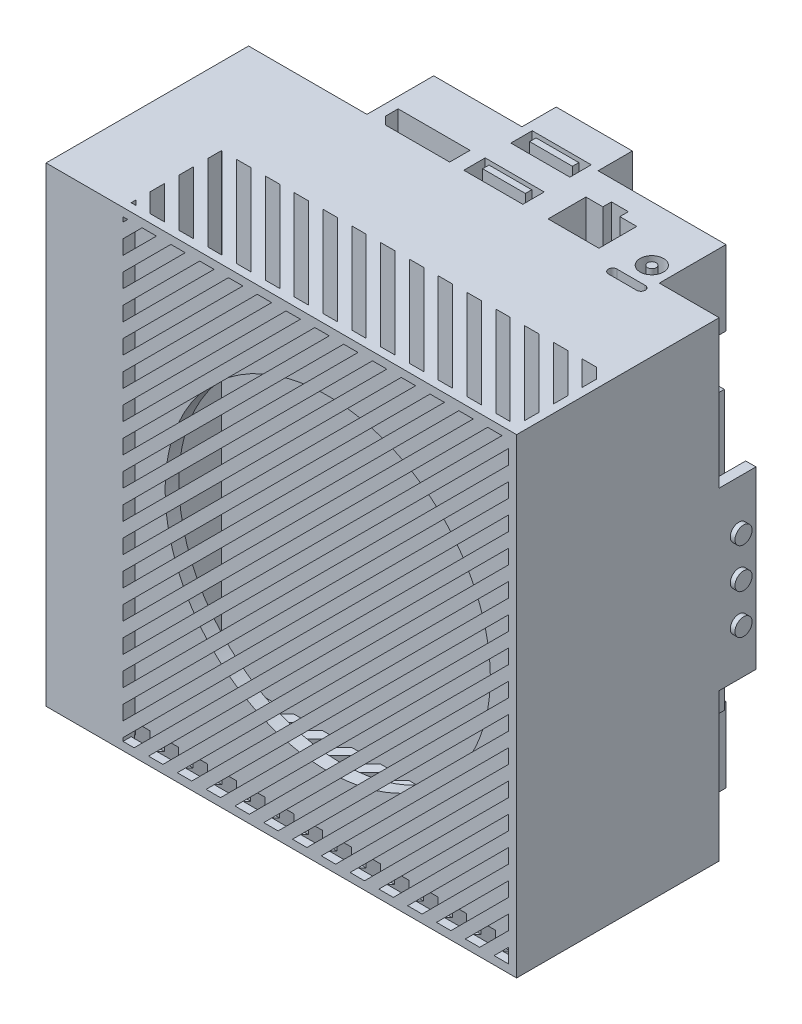
from build123d import *

# Parameters (mm, degrees)
ESQUISSE1_W              = 110
ESQUISSE1_H              = 110
ESQUISSE1_R              = 3.1
ESQUISSE1_W_2            = 105.2
ESQUISSE1_H_2            = 75
BOSS_EXTRU_1_DEPTH       = 23.6
ESQUISSE3_W              = 110
ESQUISSE3_H              = 110
BOSS_EXTRU_2_DEPTH       = 47.35
ESQUISSE15_R             = 1.25
ENL_V_MAT_EXTRU_11_DEPTH = 10
ESQUISSE4_W              = 2.4
ESQUISSE4_H              = 41
ENL_V_MAT_EXTRU_1_DEPTH  = 15
ESQUISSE5_R              = 2
BOSS_EXTRU_3_DEPTH       = 1.1
ESQUISSE6_W              = 95.2
ESQUISSE6_H              = 65
BOSS_EXTRU_4_DEPTH       = 8.6
ENL_V_MAT_EXTRU_2_DEPTH  = 2.8
ESQUISSE8_R              = 38
ENL_V_MAT_EXTRU_3_DEPTH  = 20.14
ENL_V_MAT_EXTRU_4_DEPTH  = 4.4
ENL_V_MAT_EXTRU_5_DEPTH  = 4.4
ENL_V_MAT_EXTRU_7_REACH  = 170.182
ESQUISSE11_W             = 90.1
ESQUISSE11_H             = 17
ESQUISSE12_W             = 54.13
ESQUISSE12_H             = 6.55
ESQUISSE12_W_2           = 12.5
ESQUISSE12_H_2           = 5
ESQUISSE12_W_3           = 10
ESQUISSE12_H_3           = 1.5
ENL_V_MAT_EXTRU_8_DEPTH  = 10
ESQUISSE13_R             = 2.75
ESQUISSE13_R_2           = 1
ESQUISSE13_W             = 13.8
ESQUISSE13_H             = 5
ESQUISSE13_W_2           = 10
ESQUISSE13_H_2           = 1.5
ENL_V_MAT_EXTRU_9_DEPTH  = 10
ESQUISSE14_W             = 10
ESQUISSE14_H             = 17.5
ENL_V_MAT_EXTRU_10_DEPTH = 23.6
ESQUISSE16_W             = 20.63
ESQUISSE16_H             = 18.232262646
ESQUISSE16_W_2           = 29.9
ESQUISSE16_H_2           = 17.5
ESQUISSE16_W_3           = 68.33
ENL_V_MAT_EXTRU_12_DEPTH = 8
ESQUISSE17_W             = 17.67
ESQUISSE17_H             = 17.5
ENL_V_MAT_EXTRU_13_DEPTH = 17


with BuildPart() as part:
    # Esquisse1 → Boss.-Extru.1 (new body)
    with BuildSketch(Plane.XY):
        with Locations((-55, -55)):
            Rectangle(ESQUISSE1_W, ESQUISSE1_H)
        with Locations((-87.5, -9)):
            Circle(ESQUISSE1_R, mode=Mode.SUBTRACT)
        with Locations((-8.5, -9)):
            Circle(ESQUISSE1_R, mode=Mode.SUBTRACT)
        with Locations((-87.5, -101)):
            Circle(ESQUISSE1_R, mode=Mode.SUBTRACT)
        with Locations((-8.5, -101)):
            Circle(ESQUISSE1_R, mode=Mode.SUBTRACT)
        with Locations((-55, -55)):
            Rectangle(ESQUISSE1_W_2, ESQUISSE1_H_2, mode=Mode.SUBTRACT)
    extrude(amount=BOSS_EXTRU_1_DEPTH)

    # Esquisse3 → Boss.-Extru.2 (add)
    with BuildSketch(Plane.XY.offset(23.6)):
        with Locations((-55, -55)):
            Rectangle(ESQUISSE3_W, ESQUISSE3_H)
    extrude(amount=BOSS_EXTRU_2_DEPTH)

    # Esquisse15 → Enlèv. mat.-Extru.11 (cut)
    with BuildSketch(Plane(origin=(0, 0, 23.6), x_dir=(-1, 0, 0), z_dir=(0, 0, -1))):
        with Locations((87.5, -9)):
            Circle(ESQUISSE15_R)
        with Locations((8.5, -9)):
            Circle(ESQUISSE15_R)
        with Locations((8.5, -101)):
            Circle(ESQUISSE15_R)
        with Locations((87.5, -101)):
            Circle(ESQUISSE15_R)
    extrude(amount=-ENL_V_MAT_EXTRU_11_DEPTH, mode=Mode.SUBTRACT)

    # Esquisse4 → Enlèv. mat.-Extru.1 (cut)
    with BuildSketch(Plane(origin=(0, 0, 0), x_dir=(-1, 0, 0), z_dir=(0, 0, -1))):
        with Locations((1.2, -55)):
            Rectangle(ESQUISSE4_W, ESQUISSE4_H)
    extrude(amount=-ENL_V_MAT_EXTRU_1_DEPTH, mode=Mode.SUBTRACT)

    # Esquisse5 → Boss.-Extru.3 (add)
    with BuildSketch(Plane(origin=(0, 0, 0), x_dir=(0, 0, -1), z_dir=(1, 0, 0))):
        with Locations(Location((-19, -45.7, 0), (0, 0, 180))):
            Circle(ESQUISSE5_R)
        with Locations(Location((-19, -55, 0), (0, 0, 180))):
            Circle(ESQUISSE5_R)
        with Locations(Location((-19, -64.3, 0), (0, 0, 180))):
            Circle(ESQUISSE5_R)
    extrude(amount=BOSS_EXTRU_3_DEPTH)

    # Esquisse6 → Boss.-Extru.4 (add)
    with BuildSketch(Plane(origin=(0, 0, 23.6), x_dir=(-1, 0, 0), z_dir=(0, 0, -1))):
        with Locations((55, -55)):
            Rectangle(ESQUISSE6_W, ESQUISSE6_H)
    extrude(amount=BOSS_EXTRU_4_DEPTH)

    # Esquisse7 → Enlèv. mat.-Extru.2 (cut)
    with BuildSketch(Plane.XY.offset(70.95)):
        Polygon((-1.9, -101.368343443), (-8.631656557, -108.1), (-11.997484835, -108.1), (-1.9, -98.002515165), align=None)
        Polygon((-1.9, -108.1), (-1.9, -104.734171722), (-5.265828278, -108.1), align=None)
        Polygon((-1.9, -94.636686886), (-15.363313114, -108.1), (-18.729141392, -108.1), (-1.9, -91.270858608), align=None)
        Polygon((-1.9, -87.905030329), (-22.094969671, -108.1), (-25.460797949, -108.1), (-1.9, -84.539202051), align=None)
        Polygon((-1.9, -81.173373772), (-28.826626228, -108.1), (-32.192454506, -108.1), (-1.9, -77.807545494), align=None)
        Polygon((-1.9, -74.441717216), (-35.558282784, -108.1), (-38.924111063, -108.1), (-1.9, -71.075888937), align=None)
        Polygon((-1.9, -67.710060659), (-42.289939341, -108.1), (-45.65576762, -108.1), (-1.9, -64.34423238), align=None)
        Polygon((-1.9, -60.978404102), (-49.021595898, -108.1), (-52.387424177, -108.1), (-1.9, -57.612575823), align=None)
        Polygon((-1.9, -54.246747545), (-55.753252455, -108.1), (-59.119080734, -108.1), (-1.9, -50.880919266), align=None)
        Polygon((-1.9, -47.515090988), (-62.484909012, -108.1), (-65.850737291, -108.1), (-1.9, -44.149262709), align=None)
        Polygon((-69.216565569, -108.1), (-1.9, -40.783434431), (-1.9, -37.417606153), (-72.582393847, -108.1), align=None)
        Polygon((-1.9, -34.051777874), (-75.948222126, -108.1), (-79.314050404, -108.1), (-1.9, -30.685949596), align=None)
        Polygon((-82.679878683, -108.1), (-86.045706961, -108.1), (-1.9, -23.954293039), (-1.9, -27.320121317), align=None)
        Polygon((-92, -107.322636482), (-1.9, -17.222636482), (-1.9, -20.58846476), (-89.41153524, -108.1), (-92, -108.1), align=None)
        Polygon((-92, -103.956808203), (-92, -100.590979925), (-1.9, -10.490979925), (-1.9, -13.856808203), align=None)
        Polygon((-92, -97.225151647), (-1.9, -7.125151647), (-1.9, -3.759323368), (-92, -93.859323368), align=None)
        Polygon((-92, -90.49349509), (-3.40650491, -1.9), (-6.772333189, -1.9), (-92, -87.127666811), align=None)
        Polygon((-92, -83.761838533), (-10.138161467, -1.9), (-13.503989746, -1.9), (-92, -80.396010254), align=None)
        Polygon((-92, -77.030181976), (-16.869818024, -1.9), (-20.235646303, -1.9), (-92, -73.664353697), align=None)
        Polygon((-92, -70.298525419), (-23.601474581, -1.9), (-26.967302859, -1.9), (-92, -66.932697141), align=None)
        Polygon((-92, -63.566868862), (-30.333131138, -1.9), (-33.698959416, -1.9), (-92, -60.201040584), align=None)
        Polygon((-92, -56.835212305), (-37.064787695, -1.9), (-40.430615973, -1.9), (-92, -53.469384027), align=None)
        Polygon((-92, -50.103555748), (-43.796444252, -1.9), (-47.16227253, -1.9), (-92, -46.73772747), align=None)
        Polygon((-92, -43.371899191), (-50.528100809, -1.9), (-53.893929087, -1.9), (-92, -40.006070913), align=None)
        Polygon((-92, -36.640242634), (-57.259757366, -1.9), (-60.625585644, -1.9), (-92, -33.274414356), align=None)
        Polygon((-92, -29.908586078), (-63.991413922, -1.9), (-67.357242201, -1.9), (-92, -26.542757799), align=None)
        Polygon((-92, -23.176929521), (-70.723070479, -1.9), (-74.088898758, -1.9), (-92, -19.811101242), align=None)
        Polygon((-92, -13.079444685), (-80.820555315, -1.9), (-77.454727036, -1.9), (-92, -16.445272964), align=None)
        Polygon((-92, -9.713616407), (-84.186383593, -1.9), (-87.552211872, -1.9), (-92, -6.347788128), align=None)
        Polygon((-92, -1.9), (-92, -2.98195985), (-90.91804015, -1.9), align=None)
    extrude(amount=-ENL_V_MAT_EXTRU_2_DEPTH, mode=Mode.SUBTRACT)

    # Esquisse8 → Enlèv. mat.-Extru.3 (cut)
    with BuildSketch(Plane.XY.offset(68.15)):
        with Locations((-46.95, -55)):
            Circle(ESQUISSE8_R)
    extrude(amount=-ENL_V_MAT_EXTRU_3_DEPTH, mode=Mode.SUBTRACT)

    # Esquisse9 → Enlèv. mat.-Extru.4 (cut)
    with BuildSketch(Plane(origin=(0, 0, 0), x_dir=(1, 0, 0), z_dir=(0, 1, 0))):
        Polygon((-3.40650491, -69.05), (-24.50650491, -47.95), (-27.872333189, -47.95), (-6.772333189, -69.05), align=None)
        Polygon((-10.138161467, -69.05), (-31.238161467, -47.95), (-34.603989746, -47.95), (-13.503989746, -69.05), align=None)
        Polygon((-16.869818024, -69.05), (-37.969818024, -47.95), (-41.335646303, -47.95), (-20.235646303, -69.05), align=None)
        Polygon((-23.601474581, -69.05), (-44.701474581, -47.95), (-48.067302859, -47.95), (-26.967302859, -69.05), align=None)
        Polygon((-30.333131138, -69.05), (-51.433131138, -47.95), (-54.798959416, -47.95), (-33.698959416, -69.05), align=None)
        Polygon((-37.064787695, -69.05), (-58.164787695, -47.95), (-61.530615973, -47.95), (-40.430615973, -69.05), align=None)
        Polygon((-43.796444252, -69.05), (-64.896444252, -47.95), (-68.26227253, -47.95), (-47.16227253, -69.05), align=None)
        Polygon((-50.528100809, -69.05), (-71.628100809, -47.95), (-74.993929087, -47.95), (-53.893929087, -69.05), align=None)
        Polygon((-57.259757366, -69.05), (-78.359757366, -47.95), (-81.725585644, -47.95), (-60.625585644, -69.05), align=None)
        Polygon((-63.991413922, -69.05), (-85.091413922, -47.95), (-88.457242201, -47.95), (-67.357242201, -69.05), align=None)
        Polygon((-70.723070479, -69.05), (-91.823070479, -47.95), (-92, -47.95), (-92, -51.138898758), (-74.088898758, -69.05), align=None)
        Polygon((-77.454727036, -69.05), (-92, -54.504727036), (-92, -57.870555315), (-80.820555315, -69.05), align=None)
        Polygon((-84.186383593, -69.05), (-92, -61.236383593), (-92, -64.602211872), (-87.552211872, -69.05), align=None)
        Polygon((-92, -69.05), (-92, -67.96804015), (-90.91804015, -69.05), align=None)
        Polygon((-1.9, -67.190676632), (-21.140676632, -47.95), (-17.774848353, -47.95), (-1.9, -63.824848353), align=None)
        Polygon((-1.9, -60.459020075), (-14.409020075, -47.95), (-11.043191797, -47.95), (-1.9, -57.093191797), align=None)
        Polygon((-1.9, -53.727363518), (-7.677363518, -47.95), (-4.31153524, -47.95), (-1.9, -50.36153524), align=None)
    extrude(amount=-ENL_V_MAT_EXTRU_4_DEPTH, mode=Mode.SUBTRACT)

    # Esquisse10 → Enlèv. mat.-Extru.5 (cut)
    with BuildSketch(Plane.XZ.offset(110)):
        Polygon((-1.9, 69.05), (-5.265828278, 69.05), (-1.9, 65.684171722), align=None)
        Polygon((-11.997484835, 69.05), (-1.9, 58.952515165), (-1.9, 62.318343443), (-8.631656557, 69.05), align=None)
        Polygon((-18.729141392, 69.05), (-1.9, 52.220858608), (-1.9, 55.586686886), (-15.363313114, 69.05), align=None)
        Polygon((-22.094969671, 69.05), (-1.9, 48.855030329), (-1.9, 47.95), (-4.360797949, 47.95), (-25.460797949, 69.05), align=None)
        Polygon((-28.826626228, 69.05), (-7.726626228, 47.95), (-11.092454506, 47.95), (-32.192454506, 69.05), align=None)
        Polygon((-35.558282784, 69.05), (-14.458282784, 47.95), (-17.824111063, 47.95), (-38.924111063, 69.05), align=None)
        Polygon((-42.289939341, 69.05), (-21.189939341, 47.95), (-24.55576762, 47.95), (-45.65576762, 69.05), align=None)
        Polygon((-49.021595898, 69.05), (-27.921595898, 47.95), (-31.287424177, 47.95), (-52.387424177, 69.05), align=None)
        Polygon((-55.753252455, 69.05), (-34.653252455, 47.95), (-38.019080734, 47.95), (-59.119080734, 69.05), align=None)
        Polygon((-62.484909012, 69.05), (-41.384909012, 47.95), (-44.750737291, 47.95), (-65.850737291, 69.05), align=None)
        Polygon((-69.216565569, 69.05), (-48.116565569, 47.95), (-51.482393847, 47.95), (-72.582393847, 69.05), align=None)
        Polygon((-75.948222126, 69.05), (-54.848222126, 47.95), (-58.214050404, 47.95), (-79.314050404, 69.05), align=None)
        Polygon((-82.679878683, 69.05), (-61.579878683, 47.95), (-64.945706961, 47.95), (-86.045706961, 69.05), align=None)
        Polygon((-71.677363518, 47.95), (-92, 68.272636482), (-92, 69.05), (-89.41153524, 69.05), (-68.31153524, 47.95), align=None)
        Polygon((-92, 64.906808203), (-75.043191797, 47.95), (-78.409020075, 47.95), (-92, 61.540979925), align=None)
        Polygon((-92, 58.175151647), (-81.774848353, 47.95), (-85.140676632, 47.95), (-92, 54.809323368), align=None)
        Polygon((-88.50650491, 47.95), (-92, 51.44349509), (-92, 47.95), align=None)
    extrude(amount=-ENL_V_MAT_EXTRU_5_DEPTH, mode=Mode.SUBTRACT)

    # Enlèv. mat.-Extru.7: up to this face of the body (flat: up to its plane)
    enl_v_mat_extru_7_end = Plane(part.part.faces().sort_by_distance((-15.792876395, -4.4, 58.329595835))[0])
    # Esquisse11 → Enlèv. mat.-Extru.7 (cut, up to the picked face)
    with BuildSketch(Plane.XZ.offset(105.6), mode=Mode.PRIVATE) as enl_v_mat_extru_7_sk1:
        with Locations((-46.95, 56.45)):
            Rectangle(ESQUISSE11_W, ESQUISSE11_H)
    enl_v_mat_extru_7_tool1 = split(extrude(enl_v_mat_extru_7_sk1.sketch, amount=-ENL_V_MAT_EXTRU_7_REACH, mode=Mode.PRIVATE), bisect_by=enl_v_mat_extru_7_end, keep=Keep.BOTH, mode=Mode.PRIVATE)
    add(enl_v_mat_extru_7_tool1.solids().sort_by(Axis((-46.95, -105.6, 56.45), (0, 1, 0)))[0], mode=Mode.SUBTRACT)

    # Esquisse12 → Enlèv. mat.-Extru.8 (cut)
    # profile 1 of 4: a face of its own
    with BuildSketch(Plane.XZ.offset(110)):
        with Locations((-55.265, 20.325)):
            Rectangle(ESQUISSE12_W, ESQUISSE12_H)
    # profile 2 of 4: a face of its own
    with BuildSketch(Plane.XZ.offset(110)):
        with Locations((-20.95, 18.83)):
            Rectangle(ESQUISSE12_W_2, ESQUISSE12_H_2)
        with Locations((-20.95, 18.08)):
            Rectangle(ESQUISSE12_W_3, ESQUISSE12_H_3, mode=Mode.SUBTRACT)
    # profile 3 of 4: a face of its own
    with BuildSketch(Plane.XZ.offset(110)):
        with Locations((-20.95, 10.83)):
            Rectangle(ESQUISSE12_W_2, ESQUISSE12_H_2)
        with Locations((-20.95, 10.08)):
            Rectangle(ESQUISSE12_W_3, ESQUISSE12_H_3, mode=Mode.SUBTRACT)
    # profile 4 of 4: a face of its own
    with BuildSketch(Plane.XZ.offset(110)):
        with BuildLine():
            Line((-105.3, 20.825), (-98.7, 20.825))
            ThreePointArc((-98.7, 20.825), (-97.7, 21.825), (-98.7, 22.825))
            Line((-98.7, 22.825), (-105.3, 22.825))
            ThreePointArc((-105.3, 22.825), (-106.3, 21.825), (-105.3, 20.825))
        make_face()
    extrude(amount=-ENL_V_MAT_EXTRU_8_DEPTH, mode=Mode.SUBTRACT)

    # Esquisse13 → Enlèv. mat.-Extru.9 (cut)
    # profile 1 of 6: a face of its own
    with BuildSketch(Plane(origin=(0, 0, 0), x_dir=(1, 0, 0), z_dir=(0, 1, 0))):
        with Locations(Location((-18.49, -20.85, 0), (0, 0, 270))):
            Circle(ESQUISSE13_R)
        with Locations(Location((-18.49, -20.85, 0), (0, 0, 270))):
            Circle(ESQUISSE13_R_2, mode=Mode.SUBTRACT)
    # profile 2 of 6: a face of its own
    with BuildSketch(Plane(origin=(0, 0, 0), x_dir=(1, 0, 0), z_dir=(0, 1, 0))):
        Polygon((-28.11, -23.6), (-40, -23.6), (-40, -14.75), (-36.036666667, -14.75), (-36.036666667, -12.75), (-32.073333333, -12.75), (-32.073333333, -14.75), (-28.11, -14.75), align=None)
    # profile 3 of 6: a face of its own
    with BuildSketch(Plane(origin=(0, 0, 0), x_dir=(1, 0, 0), z_dir=(0, 1, 0))):
        Polygon((-63, -23.6), (-78.04, -23.6), (-79.8, -21.84), (-79.8, -18.84), (-63, -18.84), align=None)
    # profile 4 of 6: a face of its own
    with BuildSketch(Plane(origin=(0, 0, 0), x_dir=(1, 0, 0), z_dir=(0, 1, 0))):
        with Locations((-52.8, -21.1)):
            Rectangle(ESQUISSE13_W, ESQUISSE13_H)
        with Locations((-52.8, -20.35)):
            Rectangle(ESQUISSE13_W_2, ESQUISSE13_H_2, mode=Mode.SUBTRACT)
    # profile 5 of 6: a face of its own
    with BuildSketch(Plane(origin=(0, 0, 0), x_dir=(1, 0, 0), z_dir=(0, 1, 0))):
        with Locations((-52.8, -10.1)):
            Rectangle(ESQUISSE13_W, ESQUISSE13_H)
        with Locations((-52.8, -9.35)):
            Rectangle(ESQUISSE13_W_2, ESQUISSE13_H_2, mode=Mode.SUBTRACT)
    # profile 6 of 6: a face of its own
    with BuildSketch(Plane(origin=(0, 0, 0), x_dir=(1, 0, 0), z_dir=(0, 1, 0))):
        with BuildLine():
            Line((-15.19, -27.7), (-21.79, -27.7))
            ThreePointArc((-21.79, -27.7), (-22.79, -26.7), (-21.79, -25.7))
            Line((-21.79, -25.7), (-15.19, -25.7))
            ThreePointArc((-15.19, -25.7), (-14.19, -26.7), (-15.19, -27.7))
        make_face()
    extrude(amount=-ENL_V_MAT_EXTRU_9_DEPTH, mode=Mode.SUBTRACT)

    # Esquisse14 → Enlèv. mat.-Extru.10 (cut)
    with BuildSketch(Plane(origin=(0, 0, 0), x_dir=(-1, 0, 0), z_dir=(0, 0, -1))):
        Polygon((0, -110), (14, -110), (14, -92.5), (2.4, -92.5), (2.4, -75.5), (0, -75.5), align=None)
        Polygon((0, -34.5), (2.4, -34.5), (2.4, -17.5), (14, -17.5), (14, 0), (0, 0), align=None)
        with Locations((87.33, -101.25)):
            Rectangle(ESQUISSE14_W, ESQUISSE14_H)
        Polygon((82.33, -17.5), (82.33, 0), (110, 0), (110, -92.5), (107.6, -92.5), (107.6, -17.5), align=None)
    extrude(amount=-ENL_V_MAT_EXTRU_10_DEPTH, mode=Mode.SUBTRACT)

    # Esquisse16 → Enlèv. mat.-Extru.12 (cut)
    with BuildSketch(Plane(origin=(0, 0, 0), x_dir=(-1, 0, 0), z_dir=(0, 0, -1))):
        with Locations((72.015, -8.383868677)):
            Rectangle(ESQUISSE16_W, ESQUISSE16_H)
        with Locations((28.95, -8.75)):
            Rectangle(ESQUISSE16_W_2, ESQUISSE16_H_2)
        with Locations((48.165, -101.25)):
            Rectangle(ESQUISSE16_W_3, ESQUISSE16_H_2)
    extrude(amount=-ENL_V_MAT_EXTRU_12_DEPTH, mode=Mode.SUBTRACT)

    # Esquisse17 → Enlèv. mat.-Extru.13 (cut)
    with BuildSketch(Plane(origin=(0, 0, 0), x_dir=(-1, 0, 0), z_dir=(0, 0, -1))):
        with Locations((101.165, -101.25)):
            Rectangle(ESQUISSE17_W, ESQUISSE17_H)
    extrude(amount=-ENL_V_MAT_EXTRU_13_DEPTH, mode=Mode.SUBTRACT)


solid = part.part
